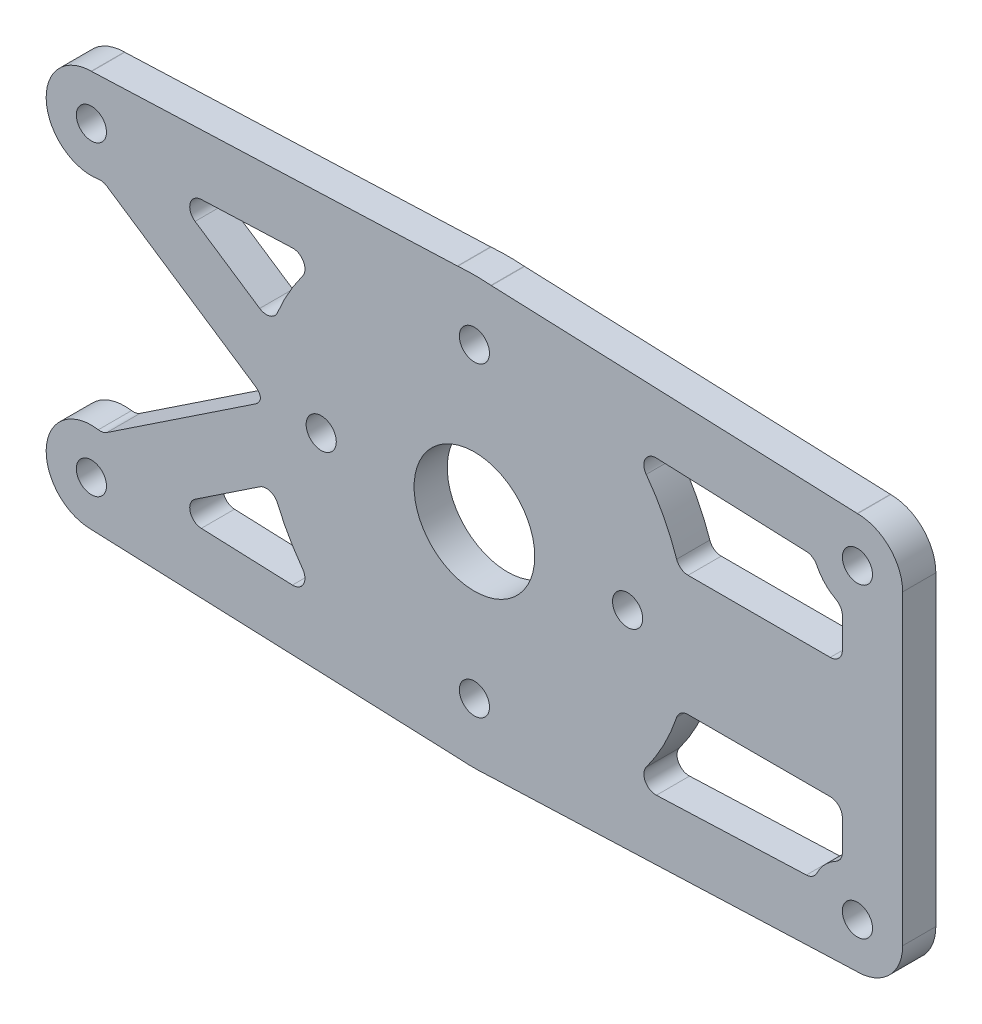
from build123d import *

# Parameters (mm, degrees)
SKETCH1_R             = 35.4
SKETCH1_R_2           = 10
SKETCH1_R_3           = 2.5
BOSS_EXTRUDE1_DEPTH   = 2.75
SKETCH1_R_4           = 7.5
BOSS_EXTRUDE1_2_DEPTH = 2.75
BOSS_EXTRUDE1_3_DEPTH = 2.75
BOSS_EXTRUDE1_4_DEPTH = 2.75
BOSS_EXTRUDE1_5_DEPTH = 2.75
SKETCH2_W             = 10
SKETCH2_H             = 10
BOSS_EXTRUDE2_DEPTH   = 5.5
BOSS_EXTRUDE3_DEPTH   = 5.5
FILLET2_R             = 2


with BuildPart() as part:
    # Sketch1 → Boss-Extrude1 (new, symmetric)
    with BuildSketch(Plane.XY):
        Circle(SKETCH1_R)
        Circle(SKETCH1_R_2, mode=Mode.SUBTRACT)
        with Locations((0, 25.4)):
            Circle(SKETCH1_R_3, mode=Mode.SUBTRACT)
        with Locations((25.4, 0)):
            Circle(SKETCH1_R_3, mode=Mode.SUBTRACT)
        with Locations((0, -25.4)):
            Circle(SKETCH1_R_3, mode=Mode.SUBTRACT)
        with Locations((-25.4, 0)):
            Circle(SKETCH1_R_3, mode=Mode.SUBTRACT)
    extrude(amount=BOSS_EXTRUDE1_DEPTH, both=True)



with BuildPart() as body_2:
    # Sketch1 → Boss-Extrude1 2 (new, symmetric)
    with BuildSketch(Plane.XY):
        with Locations((-63.5, 25.4)):
            Circle(SKETCH1_R_4)
        with Locations((-63.5, 25.4)):
            Circle(SKETCH1_R_3, mode=Mode.SUBTRACT)
    extrude(amount=BOSS_EXTRUDE1_2_DEPTH, both=True)


with BuildPart() as body_3:
    # Sketch1 → Boss-Extrude1 3 (new, symmetric)
    with BuildSketch(Plane.XY):
        with Locations(Location((-63.5, -25.4, 0), (0, 0, 180))):
            Circle(SKETCH1_R_4)
        with Locations(Location((-63.5, -25.4, 0), (0, 0, 180))):
            Circle(SKETCH1_R_3, mode=Mode.SUBTRACT)
    extrude(amount=BOSS_EXTRUDE1_3_DEPTH, both=True)


with BuildPart() as body_4:
    # Sketch1 → Boss-Extrude1 4 (new, symmetric)
    with BuildSketch(Plane.XY):
        with Locations((63.5, 25.4)):
            Circle(SKETCH1_R_4)
        with Locations((63.5, 25.4)):
            Circle(SKETCH1_R_3, mode=Mode.SUBTRACT)
    extrude(amount=BOSS_EXTRUDE1_4_DEPTH, both=True)


with BuildPart() as body_5:
    # Sketch1 → Boss-Extrude1 5 (new, symmetric)
    with BuildSketch(Plane.XY):
        with Locations(Location((63.5, -25.4, 0), (0, 0, 180))):
            Circle(SKETCH1_R_4)
        with Locations(Location((63.5, -25.4, 0), (0, 0, 180))):
            Circle(SKETCH1_R_3, mode=Mode.SUBTRACT)
    extrude(amount=BOSS_EXTRUDE1_5_DEPTH, both=True)


with BuildPart() as part_1:
    add(part.part)

    add(body_2.part)  # Boss-Extrude2 merges body 2

    add(body_3.part)  # Boss-Extrude2 merges body 3

    add(body_4.part)  # Boss-Extrude2 merges body 4

    add(body_5.part)  # Boss-Extrude2 merges body 5
    # Sketch2 → Boss-Extrude2 (add)
    with BuildSketch(Plane.XY.offset(2.75)):
        with BuildLine():
            Line((71, -10), (61, -10))
            Line((61, -10), (61, -18.328932188))
            ThreePointArc((61, -18.328932188), (67.830127019, -19.276275643), (71, -25.4))
            Line((71, -25.4), (71, -10))
        make_face()
        with Locations((66, -5)):
            Rectangle(SKETCH2_W, SKETCH2_H)
        with Locations((66, 5)):
            Rectangle(SKETCH2_W, SKETCH2_H)
        with BuildLine():
            Line((61, 18.328932188), (61, 10))
            Line((61, 10), (71, 10))
            Line((71, 10), (71, 25.4))
            ThreePointArc((71, 25.4), (67.830127019, 19.276275643), (61, 18.328932188))
        make_face()
        with BuildLine():
            Line((63.5, 32.9), (2.78308778, 35.290429615))
            ThreePointArc((2.78308778, 35.290429615), (15.233886488, 31.954478598), (25.664891372, 24.381824191))
            Line((25.664891372, 24.381824191), (56.337882251, 23.174226125))
            ThreePointArc((56.337882251, 23.174226125), (57.460823564, 29.847285461), (63.5, 32.9))
        make_face()
        with BuildLine():
            Line((61, 10), (33.958209611, 10))
            ThreePointArc((33.958209611, 10), (35.037698414, 5.051701682), (35.4, 0))
            Line((35.4, 0), (61, 0))
            Line((61, 0), (61, 10))
        make_face()
        with BuildLine():
            Line((61, 0), (35.4, 0))
            ThreePointArc((35.4, 0), (35.037698414, -5.051701682), (33.958209611, -10))
            Line((33.958209611, -10), (61, -10))
            Line((61, -10), (61, 0))
        make_face()
        with BuildLine():
            Line((-2.78308778, 35.290429615), (-63.5, 32.9))
            ThreePointArc((-63.5, 32.9), (-58.196699141, 30.703300859), (-56, 25.4))
            ThreePointArc((-56, 25.4), (-56.084951682, 24.274363096), (-56.337882251, 23.174226125))
            Line((-56.337882251, 23.174226125), (-25.664891372, 24.381824191))
            ThreePointArc((-25.664891372, 24.381824191), (-15.233886488, 31.954478598), (-2.78308778, 35.290429615))
        make_face()
        with BuildLine():
            ThreePointArc((-56, -25.4), (-58.196699141, -30.703300859), (-63.5, -32.9))
            Line((-63.5, -32.9), (-2.78308778, -35.290429615))
            ThreePointArc((-2.78308778, -35.290429615), (-15.233886488, -31.954478598), (-25.664891372, -24.381824191))
            Line((-25.664891372, -24.381824191), (-56.337882251, -23.174226125))
            ThreePointArc((-56.337882251, -23.174226125), (-56.084951682, -24.274363096), (-56, -25.4))
        make_face()
        with BuildLine():
            Line((56.337882251, -23.174226125), (25.664891372, -24.381824191))
            ThreePointArc((25.664891372, -24.381824191), (15.233886488, -31.954478598), (2.78308778, -35.290429615))
            Line((2.78308778, -35.290429615), (63.5, -32.9))
            ThreePointArc((63.5, -32.9), (57.460823564, -29.847285461), (56.337882251, -23.174226125))
        make_face()
    extrude(amount=-BOSS_EXTRUDE2_DEPTH)

    # Sketch4 → Boss-Extrude3 (add)
    with BuildSketch(Plane.XY.offset(2.75)):
        with BuildLine():
            ThreePointArc((-56.337882251, 23.174226125), (-58.32615109, 19.970332657), (-61.622198434, 18.138880164))
            Line((-61.622198434, 18.138880164), (-35.393969487, 0.653394199))
            ThreePointArc((-35.393969487, 0.653394199), (-34.869165552, 6.107478509), (-33.508987085, 11.415243516))
            Line((-33.508987085, 11.415243516), (-51.436889693, 23.367178588))
            Line((-51.436889693, 23.367178588), (-56.337882251, 23.174226125))
        make_face()
        with BuildLine():
            ThreePointArc((-33.508987085, -11.415243516), (-34.869165552, -6.107478509), (-35.393969487, -0.653394199))
            Line((-35.393969487, -0.653394199), (-61.622198434, -18.138880164))
            ThreePointArc((-61.622198434, -18.138880164), (-58.32615109, -19.970332657), (-56.337882251, -23.174226125))
            Line((-56.337882251, -23.174226125), (-51.436889693, -23.367178588))
            Line((-51.436889693, -23.367178588), (-33.508987085, -11.415243516))
        make_face()
    extrude(amount=-BOSS_EXTRUDE3_DEPTH)

    # Fillet2
    # the kernel refuses this fillet: 2 mm, written as the material it adds along each edge
    with BuildSketch(Plane(origin=(56.337882251, -23.174226125, 2.75), x_dir=(-0.9992258982289587, -0.039339602292484115, 0), z_dir=(0, 0, -1))) as fillet2_piece_1:
        with BuildLine():
            CenterArc((1.294462538, 2), FILLET2_R, 208.313479827, 61.686520173)
            ThreePointArc((-0.466269045, 1.051409313), (-0.212949992, 0.534655901), (0, 0))
            Line((0, 0), (1.294462538, 0))
        make_face()
    extrude(amount=5.5)
    with BuildSketch(Plane(origin=(63.5, -32.9, 2.75), x_dir=(-0.9992258982289565, -0.03933960229253602, 0), z_dir=(0, 0, -1)), Plane(origin=(-63.5, 32.9, 2.75), x_dir=(0.9992258982289568, 0.039339602292528475, 0), z_dir=(0, 0, -1))) as fillet2_piece_2:
        with BuildLine():
            CenterArc((0.037030979, -2), FILLET2_R, 90, 2.003215214)
            ThreePointArc((-0.032880178, -0.001222266), (-0.016439419, -0.000629164), (0, 0))
            Line((0, 0), (0.037030979, 0))
        make_face()
    extrude(amount=5.5)
    with BuildSketch(Plane(origin=(2.78308778, -35.290429615, 2.75), x_dir=(-0.9969465814298002, -0.07808657871513255, 0), z_dir=(0, 0, -1)), Plane(origin=(-2.78308778, 35.290429615, 2.75), x_dir=(0.9969465814298212, 0.07808657871486505, 0), z_dir=(0, 0, -1))) as fillet2_piece_3:
        with BuildLine():
            CenterArc((0.038828596, -1.999999716), FILLET2_R, 90.030559269, 2.193456428)
            Line((-0.038784703, -0.001506239), (0, 0))
            ThreePointArc((0, 0), (0.018880938, -5.035e-06), (0.037761876, 0))
        make_face()
    extrude(amount=5.5)
    with BuildSketch(Plane(origin=(25.664891372, -24.381824191, 2.75), x_dir=(0.9992258982289642, 0.03933960229234237, 0), z_dir=(0, 0, -1)), Plane(origin=(-25.664891372, 24.381824191, 2.75), x_dir=(-0.9992258982289642, -0.03933960229234098, 0), z_dir=(0, 0, -1))) as fillet2_piece_4:
        with BuildLine():
            CenterArc((4.511436715, -2), FILLET2_R, 90, 128.677471334)
            ThreePointArc((2.950084331, -3.249871486), (1.525458529, -1.57917008), (0, 0))
            Line((0, 0), (4.511436715, 0))
        make_face()
    extrude(amount=5.5)
    with BuildSketch(Plane(origin=(-61.622198434, 18.138880164, 2.75), x_dir=(-0.9793174714126514, -0.20232965720805937, 0), z_dir=(0, 0, -1))) as fillet2_piece_5:
        with BuildLine():
            CenterArc((0.83826772, -1.997567057), FILLET2_R, 92.826393371, 42.536898363)
            Line((-0.584884369, -0.592348878), (0, 0))
            ThreePointArc((0, 0), (0.369823994, -0.009123535), (0.739647988, 0))
        make_face()
    extrude(amount=5.5)
    with BuildSketch(Plane(origin=(-35.393969487, 0.653394199, 2.75), x_dir=(-0.0036879013948657212, -0.9999931996685285, 0), z_dir=(0, 0, -1))) as fillet2_piece_6:
        with BuildLine():
            CenterArc((1.075260701, 1.999781833), FILLET2_R, 213.478765862, 55.674941003)
            Line((-0.592919931, 0.896526024), (0, 0))
            ThreePointArc((0, 0), (0.522860286, 0.003861551), (1.045720572, 0))
        make_face()
    extrude(amount=5.5)
    with BuildSketch(Plane(origin=(-33.508987085, 11.415243516, 2.75), x_dir=(0.35490497801147736, 0.9349023781030149, 0), z_dir=(0, 0, -1))) as fillet2_piece_7:
        with BuildLine():
            CenterArc((2.509683376, -1.998811213), FILLET2_R, 91.975587393, 100.926859316)
            Line((0.560180056, -2.445394695), (0, 0))
            ThreePointArc((0, 0), (1.220368015, -0.021041537), (2.44073603, 0))
        make_face()
    extrude(amount=5.5)
    with BuildSketch(Plane(origin=(-51.436889693, 23.367178588, 2.75), x_dir=(0.9992258982289588, 0.039339602292479375, 0), z_dir=(0, 0, -1))) as fillet2_piece_8:
        with BuildLine():
            CenterArc((FILLET2_R * 3.08275000621, FILLET2_R), FILLET2_R, 125.944642492, 144.055357508)
            Line((FILLET2_R * 2.49574667672, FILLET2_R * 1.80958451762), (0, 0))
            Line((0, 0), (FILLET2_R * 3.08275000621, 0))
        make_face()
    extrude(amount=5.5)
    with BuildSketch(Plane(origin=(-35.393969487, -0.653394199, 2.75), x_dir=(-0.8320502943381687, -0.5547001962247414, 0), z_dir=(0, 0, -1))) as fillet2_piece_9:
        with BuildLine():
            CenterArc((1.074854853, 2), FILLET2_R, 214.325058997, 55.674941003)
            ThreePointArc((-0.576848648, 0.872225402), (-0.285203442, 0.43824284), (0, 0))
            Line((0, 0), (1.074854853, 0))
        make_face()
    extrude(amount=5.5)
    with BuildSketch(Plane(origin=(-61.622198434, -18.138880164, 2.75), x_dir=(-0.9793174714126522, 0.20232965720805474, 0), z_dir=(0, 0, -1))) as fillet2_piece_10:
        with BuildLine():
            CenterArc((0.83826772, 1.997567057), FILLET2_R, 224.636708266, 42.536898363)
            Line((-0.584884369, 0.592348878), (0, 0))
            ThreePointArc((0, 0), (0.369823994, 0.009123535), (0.739647988, 0))
        make_face()
    extrude(amount=5.5)
    with BuildSketch(Plane(origin=(-51.436889693, -23.367178588, 2.75), x_dir=(0.9992258982289588, -0.039339602292479375, 0), z_dir=(0, 0, -1))) as fillet2_piece_11:
        with BuildLine():
            CenterArc((FILLET2_R * 3.08275000621, -FILLET2_R), FILLET2_R, 90, 144.055357508)
            Line((FILLET2_R * 2.49574667672, -FILLET2_R * 1.80958451762), (0, 0))
            Line((0, 0), (FILLET2_R * 3.08275000621, 0))
        make_face()
    extrude(amount=5.5)
    with BuildSketch(Plane(origin=(-33.508987085, -11.415243516, 2.75), x_dir=(0.3549049780114786, -0.9349023781030145, 0), z_dir=(0, 0, -1))) as fillet2_piece_12:
        with BuildLine():
            CenterArc((2.509683376, 1.998811213), FILLET2_R, 167.09755329, 100.926859316)
            Line((0.560180056, 2.445394695), (0, 0))
            ThreePointArc((0, 0), (1.220368015, 0.021041537), (2.44073603, 0))
        make_face()
    extrude(amount=5.5)
    with BuildSketch(Plane(origin=(2.78308778, 35.290429615, 2.75), x_dir=(0.9992258982289731, -0.03933960229211439, 0), z_dir=(0, 0, -1)), Plane(origin=(-2.78308778, -35.290429615, 2.75), x_dir=(-0.9992258982289748, 0.03933960229207599, 0), z_dir=(0, 0, -1))) as fillet2_piece_13:
        with BuildLine():
            CenterArc((0.038813941, -2), FILLET2_R, 90, 2.193456428)
            ThreePointArc((-0.037733432, -0.001465412), (-0.01886652, -0.000737737), (0, 0))
            Line((0, 0), (0.038813941, 0))
        make_face()
    extrude(amount=5.5)
    with BuildSketch(Plane(origin=(25.664891372, 24.381824191, 2.75), x_dir=(0.6424820795819982, -0.7663007095233508, 0), z_dir=(0, 0, -1)), Plane(origin=(-25.664891372, -24.381824191, 2.75), x_dir=(-0.6424820795819999, 0.7663007095233495, 0), z_dir=(0, 0, -1))) as fillet2_piece_14:
        with BuildLine():
            CenterArc((4.51314016, -1.996153084), FILLET2_R, 93.554255535, 128.677471334)
            Line((3.03227511, -3.34041448), (0, 0))
            ThreePointArc((0, 0), (2.194576397, -0.068090422), (4.389152793, 0))
        make_face()
    extrude(amount=5.5)
    with BuildSketch(Plane(origin=(56.337882251, 23.174226125, 2.75), x_dir=(-0.9992258982289587, 0.03933960229248137, 0), z_dir=(0, 0, -1))) as fillet2_piece_15:
        with BuildLine():
            CenterArc((1.294462538, -2), FILLET2_R, 90, 61.686520173)
            ThreePointArc((-0.466269045, -1.051409313), (-0.212949992, -0.534655901), (0, 0))
            Line((0, 0), (1.294462538, 0))
        make_face()
    extrude(amount=5.5)
    with BuildSketch(Plane(origin=(63.5, 32.9, 2.75), x_dir=(0.9999975942192151, -0.002193525879082268, 0), z_dir=(0, 0, -1)), Plane(origin=(-63.5, -32.9, 2.75), x_dir=(-0.9999975942192149, 0.0021935258790960043, 0), z_dir=(0, 0, -1))) as fillet2_piece_16:
        with BuildLine():
            CenterArc((0.03728994, -1.999995188), FILLET2_R, 90.125679876, 2.003215214)
            Line((-0.03700542, -0.001375615), (0, 0))
            ThreePointArc((0, 0), (0.016451444, -1.8043e-05), (0.032902888, 0))
        make_face()
    extrude(amount=5.5)
    with BuildSketch(Plane(origin=(61, 18.328932188, 2.75), x_dir=(0, -1, 0), z_dir=(0, 0, -1))) as fillet2_piece_17:
        with BuildLine():
            CenterArc((1.295532453, 2), FILLET2_R, 208.273713631, 61.726286369)
            ThreePointArc((-0.465857076, 1.052631579), (-0.212703791, 0.535266539), (0, 0))
            Line((0, 0), (1.295532453, 0))
        make_face()
    extrude(amount=5.5)
    with BuildSketch(Plane(origin=(61, 10, 2.75), x_dir=(0, 1, 0), z_dir=(0, 0, -1)), Plane(origin=(61, -10, 2.75), x_dir=(-1, 0, 0), z_dir=(0, 0, -1))) as fillet2_piece_18:
        with BuildLine():
            CenterArc((FILLET2_R, -FILLET2_R), FILLET2_R, 90, 90)
            Line((0, -FILLET2_R), (0, 0))
            Line((0, 0), (FILLET2_R, 0))
        make_face()
    extrude(amount=5.5)
    with BuildSketch(Plane(origin=(33.958209611, 10, 2.75), x_dir=(1, 0, 0), z_dir=(0, 0, -1))) as fillet2_piece_19:
        with BuildLine():
            CenterArc((1.46438205, -2), FILLET2_R, 90, 71.285323263)
            ThreePointArc((-0.429874189, -1.35828877), (-0.208103282, -0.681307165), (0, 0))
            Line((0, 0), (1.46438205, 0))
        make_face()
    extrude(amount=5.5)
    with BuildSketch(Plane(origin=(33.958209611, -10, 2.75), x_dir=(-0.30173184081634197, -0.9533928341652151, 0), z_dir=(0, 0, -1))) as fillet2_piece_20:
        with BuildLine():
            CenterArc((1.464934977, -1.999595035), FILLET2_R, 91.153025508, 71.285323263)
            Line((-0.441850692, -1.396131353), (0, 0))
            ThreePointArc((0, 0), (0.712344755, -0.007167887), (1.42468951, 0))
        make_face()
    extrude(amount=5.5)
    with BuildSketch(Plane(origin=(61, -18.328932188, 2.75), x_dir=(0, 1, 0), z_dir=(0, 0, -1))) as fillet2_piece_21:
        with BuildLine():
            CenterArc((1.295532453, -2), FILLET2_R, 90, 61.726286369)
            ThreePointArc((-0.465857076, -1.052631579), (-0.212703791, -0.535266539), (0, 0))
            Line((0, 0), (1.295532453, 0))
        make_face()
    extrude(amount=5.5)


solid = part_1.part
